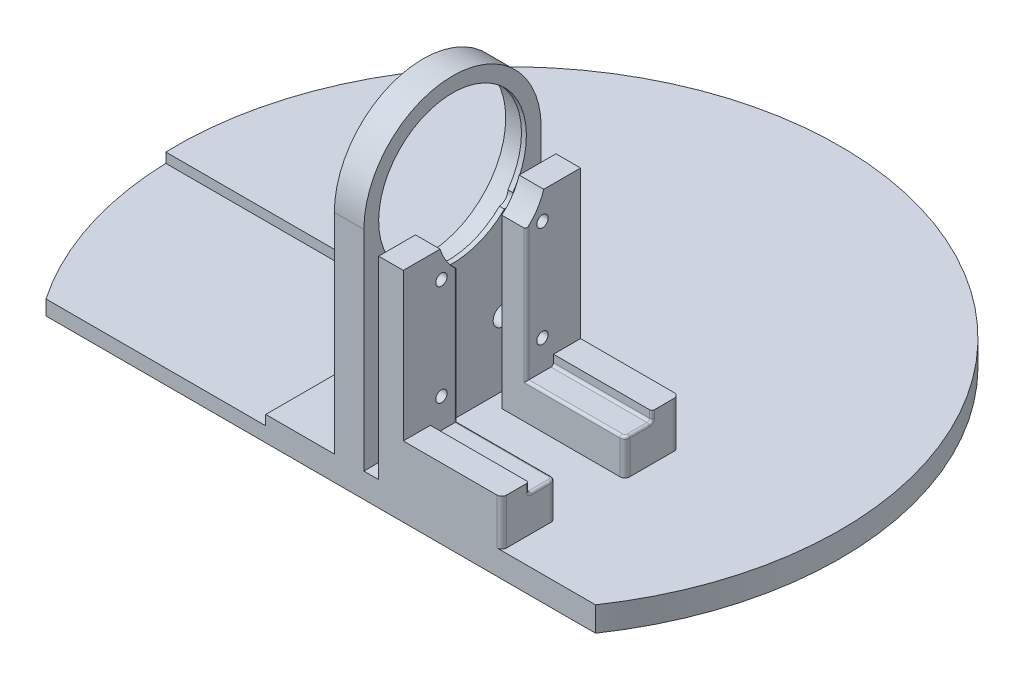
from build123d import *

# Parameters (mm, degrees)
SKETCH_1_R               = 67.5
EXTRUDE_1_DEPTH          = 5
SKETCH_2_W               = 6
SKETCH_2_H               = 35
EXTRUDE_2_DEPTH          = 60
FILLET_1_R               = 17.5
SKETCH_3_R               = 16
CUT_EXTRUDE_1_DEPTH      = 5
CHAMFER_1_SIZE           = 1.640243073
CHAMFER_1_SIZE_2         = 0.8
SKETCH_4_R               = 15
CUT_EXTRUDE_2_DEPTH      = 121.188675061
SKETCH_6_W               = 2
SKETCH_6_H               = 6
CUT_EXTRUDE_3_DEPTH      = 121.817372977
SKETCH_8_R               = 1.6
CUT_EXTRUDE_5_DEPTH      = 6
CUT_EXTRUDE_START        = -2
CUT_EXTRUDE_8_DEPTH      = 2.2
SKETCH_11_W              = 25
SKETCH_11_H              = 10.5
EXTRUDE_4_DEPTH          = 7.3
EXTRUDE_5_DEPTH          = 2
FILLET_3_R               = 1
EXTRUDE_6_DEPTH          = 5
SKETCH_14_R              = 1.15
CUT_EXTRUDE_10_DEPTH     = 127.019830237
FILLET_2_R               = 0.5
SKETCH_15_R              = 2
CUT_EXTRUDE_11_DEPTH     = 10
SKETCH_16_W              = 56.328401117
SKETCH_16_H              = 65
CUT_EXTRUDE_12_DEPTH     = 2
SKETCH_17_W              = 112.249721604
SKETCH_17_H              = 30
CUT_EXTRUDE_13_DEPTH     = 113.749722891
SKETCH2_W                = 0.5
SKETCH2_H                = 16.5
BOSS_EXTRUDE1_DEPTH      = 6
BOSS_EXTRUDE2_DEPTH      = 0.5
BOSS_EXTRUDE2_DEPTH_BACK = 3
FILLET1_R                = 1
BOSS_EXTRUDE3_DEPTH      = 0.5
SKETCH5_OUTSIDE_W        = 173.686
SKETCH5_OUTSIDE_H        = 144.186
SKETCH5_OUTSIDE_R        = 67.5
CUT_EXTRUDE1_DEPTH       = 10
SKETCH6_W                = 2.105553893
SKETCH6_H                = 9.3
BOSS_EXTRUDE4_DEPTH      = 3
FILLET2_R                = 1
CUT_EXTRUDE2_START       = -2
CUT_EXTRUDE2_DEPTH       = 2


# Some blends are built 0.0001 mm under size
with BuildPart() as part:
    # 스케치1 → 보스-돌출1 (new body)
    with BuildSketch(Plane(origin=(0, 0, 0), x_dir=(1, 0, 0), z_dir=(0, 1, 0))):
        with Locations(Location((0, 0, 0), (0, 0, 270))):
            Circle(SKETCH_1_R)
    extrude(amount=EXTRUDE_1_DEPTH)

    # 스케치2 → 보스-돌출2 (add)
    with BuildSketch(Plane(origin=(0, 5, 0), x_dir=(1, 0, 0), z_dir=(0, 1, 0))):
        with Locations((5.76, -20)):
            Rectangle(SKETCH_2_W, SKETCH_2_H)
    extrude(amount=EXTRUDE_2_DEPTH)

    # 필렛1
    fillet_1_edges = [part.edges().sort_by_distance(p)[0] for p in [
        (5.76, 65, 2.5),
        (5.76, 65, 37.5),
    ]]
    fillet(fillet_1_edges, radius=FILLET_1_R - 0.0001)  # a hair under: the kernel refuses the full size

    # 스케치3 → 컷-돌출1 (cut)
    with BuildSketch(Plane.ZY.offset(-2.76)):
        with Locations((20, 47.5)):
            Circle(SKETCH_3_R)
    extrude(amount=-CUT_EXTRUDE_1_DEPTH, mode=Mode.SUBTRACT)

    # 모따기1
    # the kernel refuses this chamfer: 1.640243073, 0.8 mm, written as the material it takes off along each edge
    with BuildSketch(Plane(origin=(2.76, 47.5, 20), x_dir=(0, 0, 1), z_dir=(0, -1, 0))) as chamfer_1_piece_1:
        Polygon((16 + CHAMFER_1_SIZE, 0), (16, -CHAMFER_1_SIZE_2), (16, 0), align=None)
    revolve(axis=Axis((2.76, 47.5, 20), (-1, 0, 0)), mode=Mode.SUBTRACT)

    # 스케치4 → 컷-돌출2 (cut, through all)
    with BuildSketch(Plane.ZY.offset(-7.76)):
        with Locations((20, 47.5)):
            Circle(SKETCH_4_R)
    extrude(amount=-CUT_EXTRUDE_2_DEPTH, mode=Mode.SUBTRACT)

    # 스케치6 → 컷-돌출3 (cut, through all)
    with BuildSketch(Plane(origin=(8.76, 0, 0), x_dir=(0, 0, -1), z_dir=(1, 0, 0))):
        with Locations((-3.5, 24.5)):
            Rectangle(SKETCH_6_W, SKETCH_6_H)
    extrude(amount=-CUT_EXTRUDE_3_DEPTH, mode=Mode.SUBTRACT)

    # 스케치8 → 컷-돌출5 (cut)
    with BuildSketch(Plane(origin=(0, 0, 4.5), x_dir=(-1, 0, 0), z_dir=(0, 0, -1))):
        with Locations((-5.76, 24.5)):
            Circle(SKETCH_8_R)
    extrude(amount=-CUT_EXTRUDE_5_DEPTH, mode=Mode.SUBTRACT)

    # 스케치9 → 컷-돌출8 (cut)
    with BuildSketch(Plane(origin=(0, 0, 4.5), x_dir=(-1, 0, 0), z_dir=(0, 0, -1)).offset(CUT_EXTRUDE_START)):
        Polygon((-4.316624327, 27), (-7.203375673, 27), (-8.646751346, 24.5), (-7.203375673, 22), (-4.316624327, 22), (-2.76, 22), (-2.76, 27), align=None)
    extrude(amount=-CUT_EXTRUDE_8_DEPTH, mode=Mode.SUBTRACT)

    # 스케치11 → 보스-돌출4 (add)
    with BuildSketch(Plane(origin=(0, 5, 0), x_dir=(1, 0, 0), z_dir=(0, 1, 0))):
        with Locations((24.26, -7.75)):
            Rectangle(SKETCH_11_W, SKETCH_11_H)
        with Locations((24.26, -32.25)):
            Rectangle(SKETCH_11_W, SKETCH_11_H)
    extrude(amount=EXTRUDE_4_DEPTH)

    # 스케치12 → 보스-돌출5 (add)
    with BuildSketch(Plane(origin=(0, 12.3, 0), x_dir=(1, 0, 0), z_dir=(0, 1, 0))):
        Polygon((16.76, -32.5), (36.76, -32.5), (36.76, -37.5), (11.76, -37.5), (11.76, -27), (16.76, -27), align=None)
        Polygon((11.76, -2.5), (36.76, -2.5), (36.76, -7.5), (16.76, -7.5), (16.76, -13), (11.76, -13), align=None)
    extrude(amount=EXTRUDE_5_DEPTH)

    # 필렛3
    fillet_3_edges = [part.edges().sort_by_distance(p)[0] for p in [
        (36.76, 9.65, 2.5),
        (36.76, 9.65, 37.5),
        (36.76, 8.65, 27),
        (36.76, 8.65, 13),
    ]]
    fillet(fillet_3_edges, radius=FILLET_3_R)

    # 스케치13 → 보스-돌출6 (add)
    with BuildSketch(Plane(origin=(16.76, 0, 0), x_dir=(0, 0, -1), z_dir=(1, 0, 0))):
        with BuildLine():
            Line((-27, 14.3), (-37.5, 14.3))
            Line((-37.5, 14.3), (-37.5, 44.3))
            Line((-37.5, 44.3), (-30.524257694, 44.3))
            ThreePointArc((-30.524257694, 44.3), (-29.151964364, 41.397414624), (-27, 39.014718626))
            Line((-27, 39.014718626), (-27, 14.3))
        make_face()
        with BuildLine():
            Line((-13, 14.3), (-2.5, 14.3))
            Line((-2.5, 14.3), (-2.5, 44.3))
            Line((-2.5, 44.3), (-9.475742306, 44.3))
            ThreePointArc((-9.475742306, 44.3), (-10.848035636, 41.397414624), (-13, 39.014718626))
            Line((-13, 39.014718626), (-13, 14.3))
        make_face()
    extrude(amount=-EXTRUDE_6_DEPTH)

    # 스케치14 → 컷-돌출10 (cut, through all)
    with BuildSketch(Plane(origin=(16.76, 0, 0), x_dir=(0, 0, -1), z_dir=(1, 0, 0))):
        with Locations((-30.25, 18.3)):
            Circle(SKETCH_14_R)
        with Locations((-9.75, 18.3)):
            Circle(SKETCH_14_R)
        with Locations((-9.75, 38.8)):
            Circle(SKETCH_14_R)
        with Locations((-30.25, 38.8)):
            Circle(SKETCH_14_R)
    extrude(amount=-CUT_EXTRUDE_10_DEPTH, mode=Mode.SUBTRACT)

    # 필렛2
    fillet_2_edges = [part.edges().sort_by_distance(p)[0] for p in [
        (26.26, 12.3, 13),
        (16.76, 25.657359313, 13),
        (26.76, 12.3, 7.5),
        (36.76, 13.3, 7.5),
        (36.76, 12.3, 30.25),
        (16.76, 25.657359313, 27),
        (26.76, 12.3, 32.5),
        (36.76, 13.3, 32.5),
        (26.26, 12.3, 27),
        (36.467106781, 12.3, 27.292893219),
        (36.76, 12.3, 9.75),
        (36.467106781, 12.3, 12.707106781),
    ]]
    fillet(fillet_2_edges, radius=FILLET_2_R)

    # 스케치15 → 컷-돌출11 (cut)
    with BuildSketch(Plane.ZY.offset(-2.76)):
        with Locations((9.75, 38.8)):
            Circle(SKETCH_15_R)
        with Locations((30.25, 38.8)):
            Circle(SKETCH_15_R)
        with Locations((9.75, 18.3)):
            Circle(SKETCH_15_R)
        with Locations((30.25, 18.3)):
            Circle(SKETCH_15_R)
    extrude(amount=-CUT_EXTRUDE_11_DEPTH, mode=Mode.SUBTRACT)

    # 스케치16 → 컷-돌출12 (cut)
    with BuildSketch(Plane(origin=(0, 5, 0), x_dir=(1, 0, 0), z_dir=(0, 1, 0))):
        with Locations((-39.335799442, -35)):
            Rectangle(SKETCH_16_W, SKETCH_16_H)
    extrude(amount=-CUT_EXTRUDE_12_DEPTH, mode=Mode.SUBTRACT)

    # 스케치17 → 컷-돌출13 (cut, through all)
    with BuildSketch(Plane(origin=(0, 5, 0), x_dir=(1, 0, 0), z_dir=(0, 1, 0))):
        with Locations((0, -52.5)):
            Rectangle(SKETCH_17_W, SKETCH_17_H)
    extrude(amount=-CUT_EXTRUDE_13_DEPTH, mode=Mode.SUBTRACT)

    # Sketch2 → Boss-Extrude1 (add)
    with BuildSketch(Plane.ZY.offset(-2.76)):
        with BuildLine():
            Line((2, 27.5), (2, 47.5))
            ThreePointArc((2, 47.5), (20, 65.5), (38, 47.5))
            Line((38, 47.5), (38, 5))
            Line((38, 5), (37.5, 5))
            Line((37.5, 5), (37.5, 45.280050522))
            Line((37.5, 45.280050522), (37.5, 47.5))
            ThreePointArc((37.5, 47.5), (32.374368671, 59.874368671), (20, 65))
            ThreePointArc((20, 65), (7.625631329, 59.874368671), (2.5, 47.5))
            Line((2.5, 47.5), (2.5, 45.280050522))
            Line((2.5, 45.280050522), (2.5, 27.5))
            Line((2.5, 27.5), (2, 27.5))
        make_face()
        with Locations((2.25, 13.25)):
            Rectangle(SKETCH2_W, SKETCH2_H)
    extrude(amount=-BOSS_EXTRUDE1_DEPTH)

    # Sketch3 → Boss-Extrude2 (add, two sides: drawn at the far end of the back side and taken through both)
    with BuildSketch(Plane(origin=(0, 0, 2.5), x_dir=(-1, 0, 0), z_dir=(0, 0, -1)).offset(-BOSS_EXTRUDE2_DEPTH_BACK)):
        Polygon((-36.76, 5), (-36.76, 14.3), (-16.76, 14.3), (-16.76, 44.3), (-11.76, 44.3), (-11.76, 5), align=None)
    extrude(amount=BOSS_EXTRUDE2_DEPTH + BOSS_EXTRUDE2_DEPTH_BACK)

    # Fillet1
    fillet1_edges = [part.edges().sort_by_distance(p)[0] for p in [
        (36.76, 9.65, 2),
    ]]
    fillet(fillet1_edges, radius=FILLET1_R)

    # Sketch4 → Boss-Extrude3 (add)
    with BuildSketch(Plane.XY.offset(37.5)):
        Polygon((11.76, 5), (8.76, 5), (2.76, 5), (-11.171598883, 5), (-11.171598883, 3), (-56.124860802, 3), (-56.124860802, 0), (56.124860802, 0), (56.124860802, 5), (35.76, 5), (35.76, 14.3), (16.76, 14.3), (16.76, 44.3), (11.76, 44.3), align=None)
    extrude(amount=BOSS_EXTRUDE3_DEPTH)

    # Sketch5 outside → Cut-Extrude1 (cut)
    with BuildSketch(Plane.XZ):
        with Locations((0, -14.75)):
            Rectangle(SKETCH5_OUTSIDE_W, SKETCH5_OUTSIDE_H)
        Circle(SKETCH5_OUTSIDE_R, mode=Mode.SUBTRACT)
    extrude(amount=-CUT_EXTRUDE1_DEPTH, mode=Mode.SUBTRACT)

    # Sketch6 → Boss-Extrude4 (add)
    with BuildSketch(Plane.XY.offset(38)):
        with Locations((35.707223054, 9.65)):
            Rectangle(SKETCH6_W, SKETCH6_H)
    extrude(amount=-BOSS_EXTRUDE4_DEPTH)

    # Fillet2
    fillet2_edges = [part.edges().sort_by_distance(p)[0] for p in [
        (36.76, 9.65, 38),
    ]]
    fillet(fillet2_edges, radius=FILLET2_R)

    # Sketch7 → Cut-Extrude2 (cut)
    with BuildSketch(Plane(origin=(0, 5, 0), x_dir=(1, 0, 0), z_dir=(0, 1, 0)).offset(CUT_EXTRUDE2_START)):
        with BuildLine():
            Line((-11.171598883, -2), (-11.171598883, -2.5))
            Line((-11.171598883, -2.5), (-67.453687816, -2.5))
            ThreePointArc((-67.453687816, -2.5), (-67.462489062, -2.250015449), (-67.470363864, -2))
            Line((-67.470363864, -2), (-11.171598883, -2))
        make_face()
    extrude(amount=CUT_EXTRUDE2_DEPTH, mode=Mode.SUBTRACT)


solid = part.part
